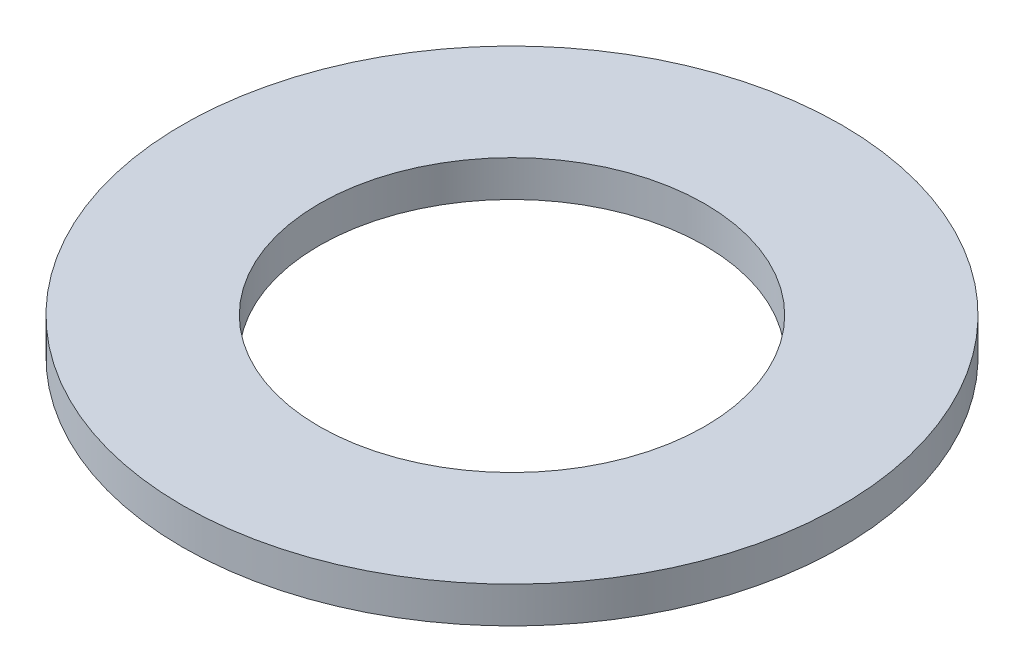
from build123d import *

# Parameters (mm, degrees)
SKETCH1_R           = 27.3
SKETCH1_R_2         = 15.975
BOSS_EXTRUDE1_DEPTH = 3


with BuildPart() as part:
    # Sketch1 → Boss-Extrude1 (new body)
    with BuildSketch(Plane(origin=(0, 0, 0), x_dir=(1, 0, 0), z_dir=(0, 1, 0))):
        Circle(SKETCH1_R)
        Circle(SKETCH1_R_2, mode=Mode.SUBTRACT)
    extrude(amount=BOSS_EXTRUDE1_DEPTH)


solid = part.part
